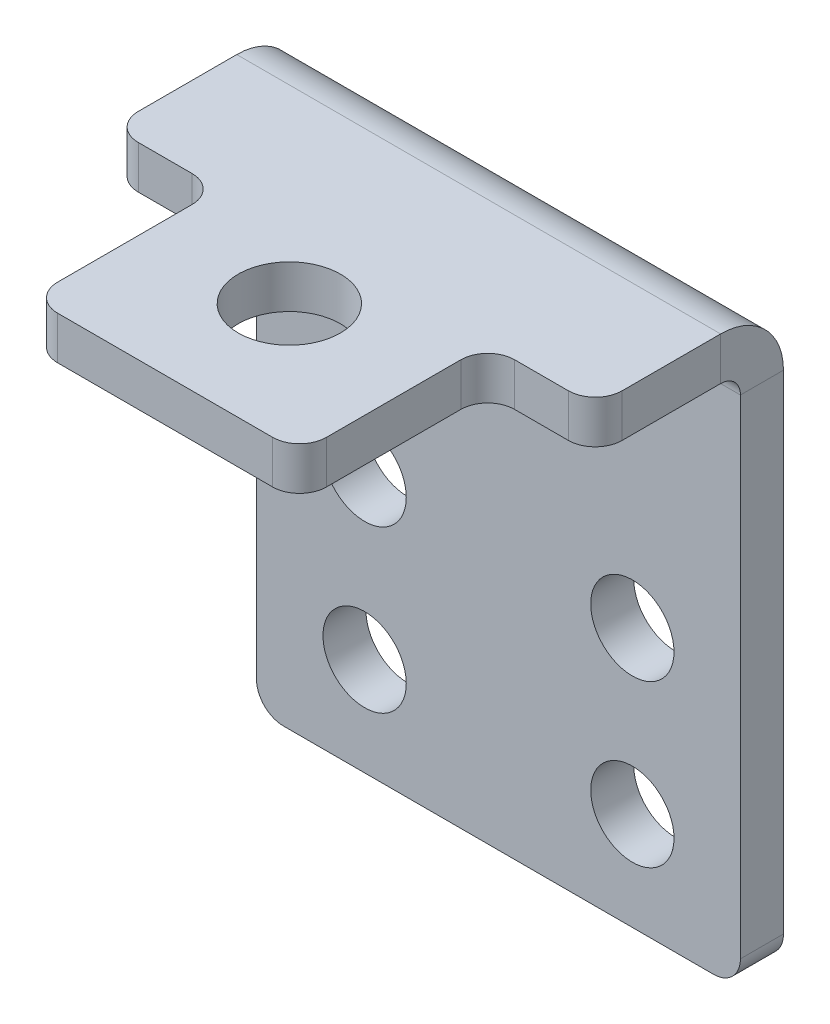
from build123d import *

# Parameters (mm, degrees)
SKETCH2_W                    = 18
SKETCH2_H                    = 21.5
BASE_FLANGE1_DEPTH           = 1.6
EDGE_FLANGE1_STRIP_W         = 7.8732
EDGE_FLANGE1_STRIP_H         = 1.6
EDGE_FLANGE1_STRIP_CUT_DEPTH = 18
EDGE_FLANGE1_DEPTH           = 18
SKETCH10_R                   = 1.9
SKETCH10_W                   = 4
SKETCH10_H                   = 7
CUT_EXTRUDE1_DEPTH           = 10
FILLET1_R                    = 1
SKETCH11_R                   = 1.5494
CUT_EXTRUDE2_DEPTH           = 10


# Sheet-metal steps are written as plain solids
with BuildPart() as part:
    # Sketch2 → Base-Flange1 (new body)
    with BuildSketch(Plane.XY):
        with Locations((9, 10.75)):
            Rectangle(SKETCH2_W, SKETCH2_H)
    extrude(amount=-BASE_FLANGE1_DEPTH)

    # Edge-Flange1 strip (across the edge) → Edge-Flange1 strip cut (cut)
    with BuildSketch(Plane(origin=(18, 21.5, 0), x_dir=(0, -1, 0), z_dir=(-1, 0, 0))):
        with Locations((-1.6, -0.8)):
            Rectangle(EDGE_FLANGE1_STRIP_W, EDGE_FLANGE1_STRIP_H)
    extrude(amount=EDGE_FLANGE1_STRIP_CUT_DEPTH, mode=Mode.SUBTRACT)

    # Edge-Flange1 section (across the edge) → Edge-Flange1 (add)
    with BuildSketch(Plane(origin=(18, 21.5, 0), x_dir=(0, -1, 0), z_dir=(-1, 0, 0))):
        with BuildLine():
            Line((0, 0.7366), (0, 12.4))
            Line((0, 12.4), (1.6, 12.4))
            Line((1.6, 12.4), (1.6, 0.7366))
            ThreePointArc((1.6, 0.7366), (1.815745145, 0.215745145), (2.3366, 0))
            Line((2.3366, 0), (2.3366, -1.6))
            ThreePointArc((2.3366, -1.6), (0.684374295, -0.915625705), (0, 0.7366))
        make_face()
    extrude(amount=EDGE_FLANGE1_DEPTH)

    # Sketch10 → Cut-Extrude1 (cut)
    with BuildSketch(Plane(origin=(0, 21.5, 0), x_dir=(1, 0, 0), z_dir=(0, 1, 0))):
        with Locations(Location((9, -7.78, 0), (0, 0, 270))):
            Circle(SKETCH10_R)
        with Locations((2, -8.9)):
            Rectangle(SKETCH10_W, SKETCH10_H)
        with Locations((16, -8.9)):
            Rectangle(SKETCH10_W, SKETCH10_H)
    extrude(amount=-CUT_EXTRUDE1_DEPTH, mode=Mode.SUBTRACT)

    # Fillet1
    fillet1_edges = [part.edges().sort_by_distance(p)[0] for p in [
        (0, 0, -0.8),
        (18, 0, -0.8),
        (0, 20.7, 5.4),
        (18, 20.7, 5.4),
        (4, 20.7, 5.4),
        (14, 20.7, 5.4),
        (14, 20.7, 12.4),
        (4, 20.7, 12.4),
    ]]
    fillet(fillet1_edges, radius=FILLET1_R)

    # Sketch11 → Cut-Extrude2 (cut)
    with BuildSketch(Plane.XY):
        with Locations((4.02, 9.65)):
            Circle(SKETCH11_R)
        with Locations((13.98, 9.65)):
            Circle(SKETCH11_R)
        with Locations((4.02, 3.65)):
            Circle(SKETCH11_R)
        with Locations((13.98, 3.65)):
            Circle(SKETCH11_R)
    extrude(amount=-CUT_EXTRUDE2_DEPTH, mode=Mode.SUBTRACT)


solid = part.part
